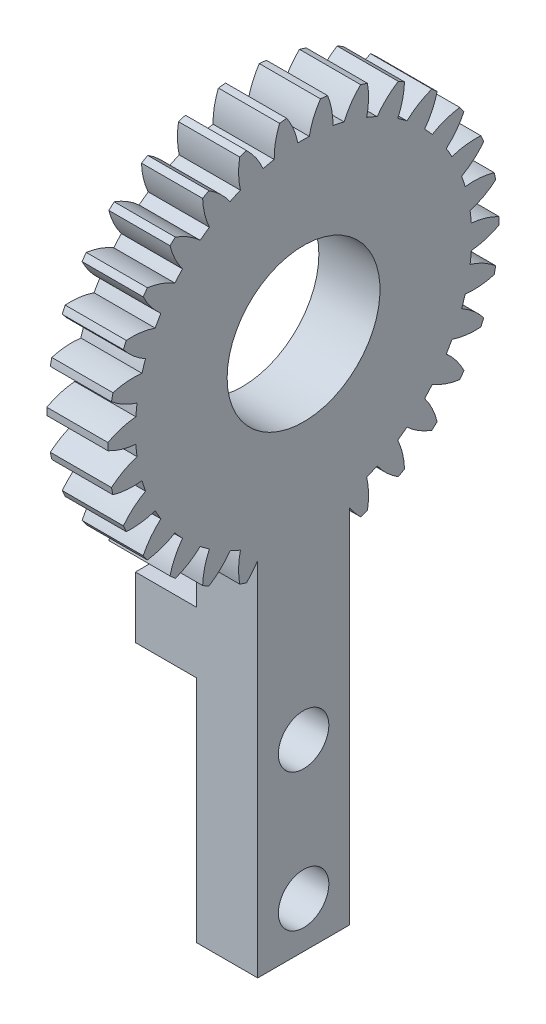
from build123d import *

# Parameters (mm, degrees)
BASPROSKE_W         = 4
BASPROSKE_H         = 12.8
TOOTHCUT_DEPTH      = 19.538608362
TEETHCUTS_COUNT     = 30
TEETHCUTS_ANGLE     = 348
BORSKE_R            = 5
BORE_DEPTH          = 50.0000508
SKETCH_1_W          = 6
SKETCH_1_H          = 28.363297546
EXTRUDE_1_DEPTH     = 4
SKETCH_4_W          = 2
SKETCH_4_H          = 15
CUT_EXTRUDE_2_DEPTH = 6
SKETCH_6_R          = 1.65
CUT_EXTRUDE_3_DEPTH = 4
EXTRUDE_START       = 2
SKETCH_8_W          = 6
SKETCH_8_H          = 15
SKETCH_8_R          = 1.65
EXTRUDE_2_DEPTH     = 2
SKETCH_9_W          = 4
SKETCH_9_H          = 4
EXTRUDE_3_DEPTH     = 6


with BuildPart() as part:
    # BasProSke → Base-Revolve (revolve)
    with BuildSketch(Plane(origin=(0, 0, 0), x_dir=(1, 0, 0), z_dir=(0, 1, 0))):
        with Locations((2, 6.4)):
            Rectangle(BASPROSKE_W, BASPROSKE_H)
    revolve(axis=Axis((-10, 0, 0), (1, 0, 0)))

    # TooCutSke → ToothCut (cut, through all)
    with BuildSketch(Plane(origin=(0, 0, 0), x_dir=(0, 0, -1), z_dir=(1, 0, 0))):
        with BuildLine():
            ThreePointArc((0.37243947, 10.992692566), (0, 10.999), (-0.37243947, 10.992692566))
            ThreePointArc((-0.37243947, 10.992692566), (-0.655704499, 11.922595954), (-1.120515575, 12.776358245))
            ThreePointArc((-1.120515575, 12.776358245), (0, 12.8254), (1.120515575, 12.776358245))
            ThreePointArc((1.120515575, 12.776358245), (0.655704499, 11.922595954), (0.37243947, 10.992692566))
        make_face()
    toothcut = extrude(amount=TOOTHCUT_DEPTH, mode=Mode.SUBTRACT)

    # TeethCuts: ToothCut ×30 about axis
    teethcuts_axis = Axis((-10, 0, 0), (1, 0, 0))
    for i in range(1, TEETHCUTS_COUNT):
        add(toothcut.rotate(teethcuts_axis, i * TEETHCUTS_ANGLE / (TEETHCUTS_COUNT - 1)), mode=Mode.SUBTRACT)

    # BorSke → Bore (cut, symmetric)
    with BuildSketch(Plane(origin=(0, 0, 0), x_dir=(0, 0, -1), z_dir=(1, 0, 0))):
        Circle(BORSKE_R)
    extrude(amount=BORE_DEPTH, both=True, mode=Mode.SUBTRACT)

    # 草图1 → 凸台-拉伸1 (add)
    with BuildSketch(Plane(origin=(4, 0, 0), x_dir=(0, 0, -1), z_dir=(1, 0, 0))):
        with Locations((0, -20.818351227)):
            Rectangle(SKETCH_1_W, SKETCH_1_H)
    extrude(amount=-EXTRUDE_1_DEPTH)

    # 草图4 → 切除-拉伸2 (cut)
    with BuildSketch(Plane(origin=(0, 0, -3), x_dir=(-1, 0, 0), z_dir=(0, 0, -1))):
        with Locations((-1, -27.5)):
            Rectangle(SKETCH_4_W, SKETCH_4_H)
    extrude(amount=-CUT_EXTRUDE_2_DEPTH, mode=Mode.SUBTRACT)

    # 草图6 → 切除-拉伸3 (cut)
    with BuildSketch(Plane.ZY.offset(-2)):
        with Locations((0, -23)):
            Circle(SKETCH_6_R)
        with Locations((0, -32)):
            Circle(SKETCH_6_R)
    extrude(amount=-CUT_EXTRUDE_3_DEPTH, mode=Mode.SUBTRACT)

    # 草图8 → 凸台-拉伸2 (add)
    with BuildSketch(Plane.ZY.offset(-2).offset(EXTRUDE_START)):
        with Locations((0, -27.5)):
            Rectangle(SKETCH_8_W, SKETCH_8_H)
        with Locations((0, -23)):
            Circle(SKETCH_8_R, mode=Mode.SUBTRACT)
        with Locations((0, -32)):
            Circle(SKETCH_8_R, mode=Mode.SUBTRACT)
    extrude(amount=-EXTRUDE_2_DEPTH)

    # 草图9 → 凸台-拉伸3 (add)
    with BuildSketch(Plane.XY.offset(3)):
        with Locations((-2, -18)):
            Rectangle(SKETCH_9_W, SKETCH_9_H)
    extrude(amount=-EXTRUDE_3_DEPTH)


solid = part.part
